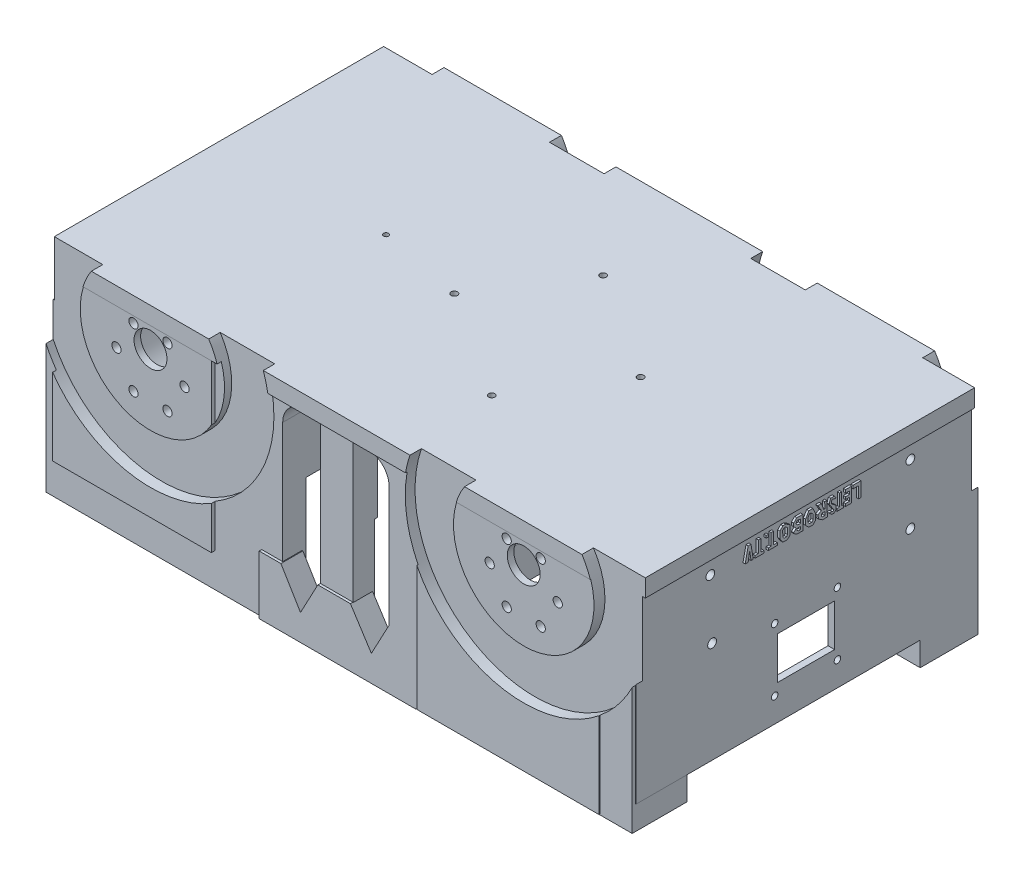
from build123d import *

# Parameters (mm, degrees)
MOTORHOLDERS_DEPTH             = 80
MOTORHOLDERS_DEPTH_BACK        = 80
MOTORHOLDERSSKETCH_R           = 23.41
MOTORHOLDERS_2_DEPTH           = 80
MOTORHOLDERS_2_DEPTH_BACK      = 80
SKETCH4_W                      = 262.774983374
SKETCH4_H                      = 153.112553215
CUT_EXTRUDE1_DEPTH             = 26
POWERBANKHOLDERS_DEPTH         = 40
POWERBANKHOLDERS_DEPTH_BACK    = 59
SKETCH6_W                      = 107.485666349
SKETCH6_H                      = 13.420779118
SKETCH6_W_2                    = 20.810206851
SKETCH6_H_2                    = 2.021058642
POWERBANKHOLDERS_2_DEPTH       = 40
POWERBANKHOLDERS_2_DEPTH_BACK  = 59
SKETCH6_W_3                    = 107.81575089
SKETCH6_H_3                    = 38.261259506
SKETCH6_W_4                    = 10.842850571
SKETCH6_H_4                    = 10.347679347
POWERBANKHOLDERS_3_DEPTH       = 40
POWERBANKHOLDERS_3_DEPTH_BACK  = 59
SKETCH6_W_5                    = 41.498763714
SKETCH6_H_5                    = 37.111507406
SKETCH6_W_6                    = 12.844328805
SKETCH6_H_6                    = 18.336479725
SKETCH6_W_7                    = 4.801433035
SKETCH6_H_7                    = 16.443461188
POWERBANKHOLDERS_4_DEPTH       = 40
POWERBANKHOLDERS_4_DEPTH_BACK  = 59
SKETCH6_W_8                    = 41.763104176
SKETCH6_H_8                    = 35.272094794
SKETCH6_W_9                    = 11.134493861
SKETCH6_H_9                    = 18.035399163
SKETCH6_W_10                   = 4.654088682
SKETCH6_H_10                   = 14.436538778
POWERBANKHOLDERS_5_DEPTH       = 40
POWERBANKHOLDERS_5_DEPTH_BACK  = 59
SKETCH6_W_11                   = 17.763333386
SKETCH6_H_11                   = 11.185766025
POWERBANKHOLDERS_6_DEPTH       = 40
POWERBANKHOLDERS_6_DEPTH_BACK  = 59
SKETCH6_W_12                   = 14.811929009
SKETCH6_H_12                   = 11.030658464
POWERBANKHOLDERS_7_DEPTH       = 40
POWERBANKHOLDERS_7_DEPTH_BACK  = 59
SKETCH6_W_13                   = 28.150495439
SKETCH6_H_13                   = 24.933985152
SKETCH6_W_14                   = 10.177859407
SKETCH6_H_14                   = 9.83070569
POWERBANKHOLDERS_8_DEPTH       = 40
POWERBANKHOLDERS_8_DEPTH_BACK  = 59
SKETCH6_W_15                   = 30.670744753
SKETCH6_H_15                   = 26.330219561
SKETCH6_W_16                   = 9.898416255
SKETCH6_H_16                   = 10.635603546
BOTTOMPLATE_DEPTH              = 5
BOTTOMPLATE_DEPTH_BACK         = 3
SKETCH21_R                     = 156.395305675
SKETCH23_W                     = 72.331231332
SKETCH23_H                     = 81.163054316
SKETCH23_W_2                   = 82.936115801
SKETCH23_H_2                   = 96.211163908
MOTORMOUNTINGSUPPORT1_DEPTH    = 6
SKETCH24_W                     = 78.341994801
SKETCH24_H                     = 94.439711356
SKETCH24_W_2                   = 53.914675369
SKETCH24_H_2                   = 86.674739968
MOTORMOUNTINGSUPPOR2_DEPTH     = 6
SKETCH17_R                     = 2.1
SKETCH17_R_2                   = 7.5
MOTORHOLES1_DEPTH              = 31.5
SKETCH19_R                     = 2.1
SKETCH19_R_2                   = 7.5
CUT_EXTRUDE4_DEPTH             = 30
BOLTHOLESSKETCH3_R             = 2.1
BOLTHOLESSKETCH3_R_2           = 7.5
MOTORHOLES3_DEPTH              = 31.5
BOLTHOLESSKETCH4_R             = 2.1
BOLTHOLESSKETCH4_R_2           = 7.5
MOTORHOLES4_DEPTH              = 15
SKETCH29_W                     = 154.635205036
SKETCH29_H                     = 84.131588093
SKETCH29_W_2                   = 26
SKETCH29_H_2                   = 19.212652328
BOSS_EXTRUDE8_DEPTH            = 3
SKETCH27_W                     = 226.46009322
SKETCH27_H                     = 129.985211715
BOSS_EXTRUDE6_DEPTH            = 3
SKETCH40_W                     = 33.841577611
SKETCH40_H                     = 31.531825246
BOSS_EXTRUDE11_DEPTH           = 40
FILLET2_R                      = 15
FILLET3_R                      = 15
POWERBANKCUT_START             = -54.404272
POWERBANKCUT_DEPTH             = 54.404272
MOTORHOLDERCUT_DEPTH           = 77
MOTORHOLDERCUT_DEPTH_BACK      = 77
MOTORHOLDEREXTRUDESKETCH_R     = 20.415
SKETCH31_W                     = 0.974071503
SKETCH31_H                     = 1.098893481
LABEL_DEPTH                    = 1
BASEDEFININGCUT_DEPTH          = 20
BASEDEFININGCUT_DEPTH_BACK     = 20
SKETCH32_W                     = 420.045569038
SKETCH32_H                     = 425.046527557
SKETCH32_W_2                   = 269.205670794
SKETCH32_H_2                   = 160.645125556
SKETCH36_R                     = 14
HOLEFORPOWERCONNECTOR_DEPTH    = 17
SKETCH37_W                     = 55.340133611
SKETCH37_H                     = 29.7708905
CUT_EXTRUDE7_DEPTH             = 36
SKETCH38_R                     = 1.145182774
CUT_EXTRUDE8_DEPTH             = 10
SPACEFORWHEEL1_DEPTH           = 10
SPACEFORWHEEL1_DEPTH_BACK      = 5
SKETCH41_R                     = 54.5
SKETCH41_R_2                   = 32
CUT_EXTRUDE10_DEPTH            = 10
CUT_EXTRUDE10_DEPTH_BACK       = 5
SKETCH42_R                     = 54.5
SKETCH42_R_2                   = 32
CUT_EXTRUDE11_DEPTH            = 10
CUT_EXTRUDE11_DEPTH_BACK       = 5
SKETCH43_R                     = 54.5
SKETCH43_R_2                   = 32
CUT_EXTRUDE12_DEPTH            = 10
CUT_EXTRUDE12_DEPTH_BACK       = 5
SKETCH44_R                     = 54.5
SKETCH44_R_2                   = 32
SKETCH45_W                     = 114.137539603
SKETCH45_H                     = 98.697181704
BACKPLATE_DEPTH                = 2
FILLET8_R                      = 10
FILLET9_R                      = 10
FILLET10_R                     = 10
FILLET11_R                     = 10
BOSS_EXTRUDE12_DEPTH           = 10
BOSS_EXTRUDE13_DEPTH           = 9
HOLESFORRASPIMOUNTING_R        = 1.414568566
HOLESFORRASPIMOUNTING_R_2      = 1.453568018
HOLESFORRASPIMOUNTING_R_3      = 1.430265165
HOLESFORRASPIMOUNTING_R_4      = 1.406429506
CUT_EXTRUDE13_DEPTH            = 252.922030729
HOLESFORCHARGINGPLATESSKETCH_R = 2
HOLESFORCHARGINGPLATES_DEPTH   = 3
SKETCH56_R                     = 1.5
CAMERASCREWHOLES_DEPTH         = 3


with BuildPart() as part:
    # MotorHoldersSketch → MotorHolders (new, two sides: drawn at the far end of the back side and taken through both)
    with BuildSketch(Plane.XY.offset(-MOTORHOLDERS_DEPTH_BACK)):
        Circle(MOTORHOLDERSSKETCH_R)
    extrude(amount=MOTORHOLDERS_DEPTH + MOTORHOLDERS_DEPTH_BACK)


with BuildPart() as body_2:
    # MotorHoldersSketch → MotorHolders 2 (new, two sides: drawn at the far end of the back side and taken through both)
    with BuildSketch(Plane.XY.offset(-MOTORHOLDERS_2_DEPTH_BACK)):
        with Locations((170, 0)):
            Circle(MOTORHOLDERSSKETCH_R)
    extrude(amount=MOTORHOLDERS_2_DEPTH + MOTORHOLDERS_2_DEPTH_BACK)


with BuildPart() as cut_extrude1_tool:
    # Sketch4 → Cut-Extrude1 (new body)
    with BuildSketch(Plane(origin=(0, 0, 0), x_dir=(1, 0, 0), z_dir=(0, 1, 0))):
        with Locations((89.893628689, 0.176832173)):
            Rectangle(SKETCH4_W, SKETCH4_H)
    extrude(amount=-CUT_EXTRUDE1_DEPTH)


with BuildPart() as part_1:
    add(part.part)

    # Cut-Extrude1: cut by cut_extrude1_tool
    add(cut_extrude1_tool.part, mode=Mode.SUBTRACT)


with BuildPart() as body_2_1:
    add(body_2.part)

    # Cut-Extrude1: cut by cut_extrude1_tool
    add(cut_extrude1_tool.part, mode=Mode.SUBTRACT)


with BuildPart() as body_3:
    # Sketch6 → PowerBankHolders (new, two sides: drawn at the far end of the back side and taken through both)
    with BuildSketch(Plane(origin=(170, -34.829272125, 0), x_dir=(-1, 0, 0), z_dir=(0, -1, 0)).offset(-POWERBANKHOLDERS_DEPTH_BACK)):
        with Locations((165.843013364, 72.238602394)):
            Rectangle(SKETCH6_W, SKETCH6_H)
        with Locations((203.359863582, 72.025840015)):
            Rectangle(SKETCH6_W_2, SKETCH6_H_2, mode=Mode.SUBTRACT)
    extrude(amount=POWERBANKHOLDERS_DEPTH + POWERBANKHOLDERS_DEPTH_BACK)



with BuildPart() as body_4:
    # Sketch6 → PowerBankHolders 2 (new, two sides: drawn at the far end of the back side and taken through both)
    with BuildSketch(Plane(origin=(170, -34.829272125, 0), x_dir=(-1, 0, 0), z_dir=(0, -1, 0)).offset(-POWERBANKHOLDERS_2_DEPTH_BACK)):
        with Locations((165.406852056, -59.151522269)):
            Rectangle(SKETCH6_W_3, SKETCH6_H_3)
        with Locations((206.519672379, -65.314281269)):
            Rectangle(SKETCH6_W_4, SKETCH6_H_4, mode=Mode.SUBTRACT)
    extrude(amount=POWERBANKHOLDERS_2_DEPTH + POWERBANKHOLDERS_2_DEPTH_BACK)


with BuildPart() as body_5:
    # Sketch6 → PowerBankHolders 3 (new, two sides: drawn at the far end of the back side and taken through both)
    with BuildSketch(Plane(origin=(170, -34.829272125, 0), x_dir=(-1, 0, 0), z_dir=(0, -1, 0)).offset(-POWERBANKHOLDERS_3_DEPTH_BACK)):
        with Locations((40.739743063, 59.306920349)):
            Rectangle(SKETCH6_W_5, SKETCH6_H_5)
        with Locations((34.93306737, 60.00949088)):
            Rectangle(SKETCH6_W_6, SKETCH6_H_6, mode=Mode.SUBTRACT)
        with Locations((56.270377412, 59.541495334)):
            Rectangle(SKETCH6_W_7, SKETCH6_H_7, mode=Mode.SUBTRACT)
    extrude(amount=POWERBANKHOLDERS_3_DEPTH + POWERBANKHOLDERS_3_DEPTH_BACK)


with BuildPart() as body_6:
    # Sketch6 → PowerBankHolders 4 (new, two sides: drawn at the far end of the back side and taken through both)
    with BuildSketch(Plane(origin=(170, -34.829272125, 0), x_dir=(-1, 0, 0), z_dir=(0, -1, 0)).offset(-POWERBANKHOLDERS_4_DEPTH_BACK)):
        with Locations((40.966801585, -61.807610384)):
            Rectangle(SKETCH6_W_8, SKETCH6_H_8)
        with Locations((37.73953158, -63.792391966)):
            Rectangle(SKETCH6_W_9, SKETCH6_H_9, mode=Mode.SUBTRACT)
        with Locations((54.037759341, -62.645522509)):
            Rectangle(SKETCH6_W_10, SKETCH6_H_10, mode=Mode.SUBTRACT)
    extrude(amount=POWERBANKHOLDERS_4_DEPTH + POWERBANKHOLDERS_4_DEPTH_BACK)


with BuildPart() as body_7:
    # Sketch6 → PowerBankHolders 5 (new, two sides: drawn at the far end of the back side and taken through both)
    with BuildSketch(Plane(origin=(170, -34.829272125, 0), x_dir=(-1, 0, 0), z_dir=(0, -1, 0)).offset(-POWERBANKHOLDERS_5_DEPTH_BACK)):
        with Locations((88.297855443, 73.356108941)):
            Rectangle(SKETCH6_W_11, SKETCH6_H_11)
    extrude(amount=POWERBANKHOLDERS_5_DEPTH + POWERBANKHOLDERS_5_DEPTH_BACK)


with BuildPart() as body_8:
    # Sketch6 → PowerBankHolders 6 (new, two sides: drawn at the far end of the back side and taken through both)
    with BuildSketch(Plane(origin=(170, -34.829272125, 0), x_dir=(-1, 0, 0), z_dir=(0, -1, 0)).offset(-POWERBANKHOLDERS_6_DEPTH_BACK)):
        with Locations((86.822153254, -72.76682279)):
            Rectangle(SKETCH6_W_12, SKETCH6_H_12)
    extrude(amount=POWERBANKHOLDERS_6_DEPTH + POWERBANKHOLDERS_6_DEPTH_BACK)


with BuildPart() as body_9:
    # Sketch6 → PowerBankHolders 7 (new, two sides: drawn at the far end of the back side and taken through both)
    with BuildSketch(Plane(origin=(170, -34.829272125, 0), x_dir=(-1, 0, 0), z_dir=(0, -1, 0)).offset(-POWERBANKHOLDERS_7_DEPTH_BACK)):
        with Locations((-34.775388772, -66.976665205)):
            Rectangle(SKETCH6_W_13, SKETCH6_H_13)
        with Locations((-36.725173705, -67.894738702)):
            Rectangle(SKETCH6_W_14, SKETCH6_H_14, mode=Mode.SUBTRACT)
    extrude(amount=POWERBANKHOLDERS_7_DEPTH + POWERBANKHOLDERS_7_DEPTH_BACK)


with BuildPart() as body_10:
    # Sketch6 → PowerBankHolders 8 (new, two sides: drawn at the far end of the back side and taken through both)
    with BuildSketch(Plane(origin=(170, -34.829272125, 0), x_dir=(-1, 0, 0), z_dir=(0, -1, 0)).offset(-POWERBANKHOLDERS_8_DEPTH_BACK)):
        with Locations((-33.722690809, 64.697564271)):
            Rectangle(SKETCH6_W_15, SKETCH6_H_15)
        with Locations((-36.585452129, 63.859928969)):
            Rectangle(SKETCH6_W_16, SKETCH6_H_16, mode=Mode.SUBTRACT)
    extrude(amount=POWERBANKHOLDERS_8_DEPTH + POWERBANKHOLDERS_8_DEPTH_BACK)


with BuildPart() as body_3_1:
    add(body_3.part)

    add(body_4.part)  # BottomPlate merges body 4

    add(body_2_1.part)  # BottomPlate merges body 2

    add(part_1.part)  # BottomPlate merges part

    add(body_5.part)  # BottomPlate merges body 5

    add(body_6.part)  # BottomPlate merges body 6
    # Sketch21 → BottomPlate (add, two sides: drawn at the far end of the back side and taken through both)
    with BuildSketch(Plane(origin=(0, 19.575, 0), x_dir=(1, 0, 0), z_dir=(0, 1, 0)).offset(-BOTTOMPLATE_DEPTH_BACK)):
        with Locations(Location((85, 0, 0), (0, 0, 270))):
            Circle(SKETCH21_R)
    extrude(amount=BOTTOMPLATE_DEPTH + BOTTOMPLATE_DEPTH_BACK)


    add(body_9.part)  # MotorMountingSupport1 merges body 9
    # Sketch23 → MotorMountingSupport1 (add)
    with BuildSketch(Plane.XY.offset(80)):
        with Locations((-8.424510745, -18.741332274)):
            Rectangle(SKETCH23_W, SKETCH23_H)
        with Locations((162.789906406, -26.26538707)):
            Rectangle(SKETCH23_W_2, SKETCH23_H_2)
    extrude(amount=-MOTORMOUNTINGSUPPORT1_DEPTH)


    add(body_10.part)  # MotorMountingSuppor2 merges body 10
    # Sketch24 → MotorMountingSuppor2 (add)
    with BuildSketch(Plane(origin=(0, 0, -80), x_dir=(-1, 0, 0), z_dir=(0, 0, -1))):
        with Locations((-163.019522912, -27.982448794)):
            Rectangle(SKETCH24_W, SKETCH24_H)
        with Locations((2.593149567, -20.814772641)):
            Rectangle(SKETCH24_W_2, SKETCH24_H_2)
    extrude(amount=-MOTORMOUNTINGSUPPOR2_DEPTH)

    # Sketch17 → MotorHoles1 (cut)
    with BuildSketch(Plane.XY.offset(80)):
        with Locations((185.5, 0)):
            Circle(SKETCH17_R)
        with Locations((177.75, -13.42)):
            Circle(SKETCH17_R)
        with Locations((162.25, -13.42)):
            Circle(SKETCH17_R)
        with Locations((154.5, 0)):
            Circle(SKETCH17_R)
        with Locations((162.25, 13.42)):
            Circle(SKETCH17_R)
        with Locations((177.75, 13.42)):
            Circle(SKETCH17_R)
        with Locations((170, 7)):
            Circle(SKETCH17_R_2)
    extrude(amount=-MOTORHOLES1_DEPTH, mode=Mode.SUBTRACT)

    # Sketch19 → Cut-Extrude4 (cut)
    with BuildSketch(Plane(origin=(0, 0, -80), x_dir=(-1, 0, 0), z_dir=(0, 0, -1))):
        with Locations(Location((-185.5, 0, 0), (0, 0, 180))):
            Circle(SKETCH19_R)
        with Locations(Location((-177.75, -13.42, 0), (0, 0, 180))):
            Circle(SKETCH19_R)
        with Locations(Location((-162.25, -13.42, 0), (0, 0, 180))):
            Circle(SKETCH19_R)
        with Locations(Location((-154.5, 0, 0), (0, 0, 180))):
            Circle(SKETCH19_R)
        with Locations(Location((-162.25, 13.42, 0), (0, 0, 180))):
            Circle(SKETCH19_R)
        with Locations(Location((-177.75, 13.42, 0), (0, 0, 180))):
            Circle(SKETCH19_R)
        with Locations(Location((-170, 7, 0), (0, 0, 180))):
            Circle(SKETCH19_R_2)
    extrude(amount=-CUT_EXTRUDE4_DEPTH, mode=Mode.SUBTRACT)

    # BoltHolesSketch3 → MotorHoles3 (cut)
    with BuildSketch(Plane.XY.offset(80)):
        with Locations((7.75, -13.42)):
            Circle(BOLTHOLESSKETCH3_R)
        with Locations((15.5, 0)):
            Circle(BOLTHOLESSKETCH3_R)
        with Locations((7.75, 13.42)):
            Circle(BOLTHOLESSKETCH3_R)
        with Locations((-7.75, 13.42)):
            Circle(BOLTHOLESSKETCH3_R)
        with Locations((-15.5, 0)):
            Circle(BOLTHOLESSKETCH3_R)
        with Locations((-7.75, -13.42)):
            Circle(BOLTHOLESSKETCH3_R)
        with Locations((0, 7)):
            Circle(BOLTHOLESSKETCH3_R_2)
    extrude(amount=-MOTORHOLES3_DEPTH, mode=Mode.SUBTRACT)

    # BoltHolesSketch4 → MotorHoles4 (cut)
    with BuildSketch(Plane(origin=(0, 0, -80), x_dir=(-1, 0, 0), z_dir=(0, 0, -1))):
        with Locations(Location((-15.5, 0, 0), (0, 0, 180))):
            Circle(BOLTHOLESSKETCH4_R)
        with Locations(Location((-7.75, 13.42, 0), (0, 0, 180))):
            Circle(BOLTHOLESSKETCH4_R)
        with Locations(Location((7.75, 13.42, 0), (0, 0, 180))):
            Circle(BOLTHOLESSKETCH4_R)
        with Locations(Location((15.5, 0, 0), (0, 0, 180))):
            Circle(BOLTHOLESSKETCH4_R)
        with Locations(Location((7.75, -13.42, 0), (0, 0, 180))):
            Circle(BOLTHOLESSKETCH4_R)
        with Locations(Location((-7.75, -13.42, 0), (0, 0, 180))):
            Circle(BOLTHOLESSKETCH4_R)
        with Locations(Location((0, 7, 0), (0, 0, 180))):
            Circle(BOLTHOLESSKETCH4_R_2)
    extrude(amount=-MOTORHOLES4_DEPTH, mode=Mode.SUBTRACT)

    # Sketch29 → Boss-Extrude8 (add)
    with BuildSketch(Plane(origin=(219.058063185, 0, 0), x_dir=(0, 0, -1), z_dir=(1, 0, 0))):
        with Locations((-0.622085312, -21.859578752)):
            Rectangle(SKETCH29_W, SKETCH29_H)
        with Locations((-0.45071267, -38.546737855)):
            Rectangle(SKETCH29_W_2, SKETCH29_H_2, mode=Mode.SUBTRACT)
    extrude(amount=-BOSS_EXTRUDE8_DEPTH)

    # Sketch27 → Boss-Extrude6 (add)
    with BuildSketch(Plane(origin=(0, 16.575, 0), x_dir=(-1, 0, 0), z_dir=(0, -1, 0))):
        with Locations((-81.596376522, -0.440920076)):
            Rectangle(SKETCH27_W, SKETCH27_H)
    extrude(amount=-BOSS_EXTRUDE6_DEPTH)

    # Sketch40 → Boss-Extrude11 (add)
    with BuildSketch(Plane.XZ.offset(-16.575)):
        with Locations((-32.665057733, -49.762300212)):
            Rectangle(SKETCH40_W, SKETCH40_H)
    extrude(amount=BOSS_EXTRUDE11_DEPTH)

    # Fillet2
    fillet2_edges = [body_3_1.edges().sort_by_distance(p)[0] for p in [
        (-33.058778866, 16.575, -33.996387589),
    ]]
    fillet(fillet2_edges, radius=FILLET2_R)

    # Fillet3
    fillet3_edges = [body_3_1.edges().sort_by_distance(p)[0] for p in [
        (-32.665057733, -23.425, -65.528212835),
    ]]
    fillet(fillet3_edges, radius=FILLET3_R)


with BuildPart() as powerbankcut_tool:
    # Sketch11 → PowerBankCut (new body)
    with BuildSketch(Plane(origin=(0, -20.425, 0), x_dir=(1, 0, 0), z_dir=(0, 1, 0)).offset(POWERBANKCUT_START)):
        Polygon((-34.216190018, -64.758061011), (-34.216190018, 73.342459946), (204.216190018, 63.61100878), (204.216190018, -72.195407715), align=None)
    extrude(amount=POWERBANKCUT_DEPTH)


with BuildPart() as body_3_2:
    add(body_3_1.part)

    # PowerBankCut: cut by powerbankcut_tool
    add(powerbankcut_tool.part, mode=Mode.SUBTRACT)

    # MotorHolderExtrudeSketch → MotorHolderCut (cut, two sides: drawn at the far end of the back side and taken through both)
    with BuildSketch(Plane.XY.offset(-MOTORHOLDERCUT_DEPTH_BACK)):
        with Locations((170, 0)):
            Circle(MOTORHOLDEREXTRUDESKETCH_R)
        Circle(MOTORHOLDEREXTRUDESKETCH_R)
    extrude(amount=MOTORHOLDERCUT_DEPTH + MOTORHOLDERCUT_DEPTH_BACK, mode=Mode.SUBTRACT)

    # Sketch31 → Label (add)
    # profile 1 of 12: a face of its own
    with BuildSketch(Plane(origin=(219.058063185, 0, 0), x_dir=(0, 0, -1), z_dir=(1, 0, 0))):
        Polygon((-11.98526985, 13.439841291), (-13.362429362, 12.062681779), (-13.362429362, 8.945190615), (-11.98526985, 6.974827343), (-9.953373529, 6.95345362), (-8.833106325, 8.073720824), (-8.833106325, 12.34094781), (-10.701068375, 13.439841291), align=None)
        Polygon((-10.345814415, 8.2738545), (-9.953373529, 8.945190615), (-9.953373529, 11.821646598), (-10.901774719, 12.34094781), (-11.49193497, 12.34094781), (-12.148090666, 11.684792113), (-11.98526985, 8.945190615), (-11.49193497, 8.2738545), align=None, mode=Mode.SUBTRACT)
    # profile 2 of 12: a face of its own
    with BuildSketch(Plane(origin=(219.058063185, 0, 0), x_dir=(0, 0, -1), z_dir=(1, 0, 0))):
        Polygon((23.558293829, 6.787698441), (23.558293829, 13.439841291), (19.973591213, 13.439841291), (19.973591213, 12.023569573), (22.495339762, 12.023569573), (22.495339762, 6.787698441), align=None)
    # profile 3 of 12: a face of its own
    with BuildSketch(Plane(origin=(219.058063185, 0, 0), x_dir=(0, 0, -1), z_dir=(1, 0, 0))):
        Polygon((19.346446684, 13.439841291), (19.346446684, 6.787698441), (16.517360922, 6.787698441), (16.517360922, 7.948175313), (18.37406964, 7.948175313), (18.37406964, 9.531498705), (16.517360922, 9.531498705), (16.517360922, 10.627422136), (18.37406964, 10.627422136), (18.37406964, 12.023569573), (16.517360922, 12.023569573), (16.517360922, 13.439841291), align=None)
    # profile 4 of 12: a face of its own
    with BuildSketch(Plane(origin=(219.058063185, 0, 0), x_dir=(0, 0, -1), z_dir=(1, 0, 0))):
        Polygon((15.6230908, 6.787698441), (15.6230908, 7.948175313), (14.771034344, 7.948175313), (14.771034344, 13.439841291), (13.818992027, 13.439841291), (13.818992027, 7.948175313), (12.716212392, 7.948175313), (12.716212392, 6.787698441), align=None)
    # profile 5 of 12: a face of its own
    with BuildSketch(Plane(origin=(219.058063185, 0, 0), x_dir=(0, 0, -1), z_dir=(1, 0, 0))):
        Polygon((9.073737582, 7.948175313), (10.234214453, 6.787698441), (11.244633534, 6.787698441), (12.155982843, 7.69904775), (12.155982843, 9.531498705), (10.234214453, 10.87364909), (10.108627026, 12.023569573), (10.670416344, 12.771980083), (11.244633534, 12.34094781), (12.155982843, 12.34094781), (11.481366322, 13.439841291), (9.687471608, 13.439841291), (9.073737582, 11.400796773), (11.244633534, 8.073720824), (10.670416344, 7.69904775), (10.234214453, 7.948175313), align=None)
    # profile 6 of 12: a face of its own
    with BuildSketch(Plane(origin=(219.058063185, 0, 0), x_dir=(0, 0, -1), z_dir=(1, 0, 0))):
        Polygon((-20.664013689, 6.974827343), (-20.664013689, 8.073720824), (-22.08006238, 8.073720824), (-22.08006238, 13.439841291), (-23.226194473, 13.439841291), (-23.226194473, 8.073720824), (-24.618837263, 8.073720824), (-24.618837263, 6.974827343), align=None)
    # profile 7 of 12: a face of its own
    with BuildSketch(Plane(origin=(219.058063185, 0, 0), x_dir=(0, 0, -1), z_dir=(1, 0, 0))):
        with Locations((-19.147573552, 12.890394551)):
            Rectangle(SKETCH31_W, SKETCH31_H)
    # profile 8 of 12: a face of its own
    with BuildSketch(Plane(origin=(219.058063185, 0, 0), x_dir=(0, 0, -1), z_dir=(1, 0, 0))):
        Polygon((8.012217861, 13.439841291), (8.252984515, 6.787698441), (6.012763426, 6.787698441), (4.268498284, 7.948175313), (3.899074993, 9.786306376), (5.542554696, 10.627422136), (3.899074993, 13.439841291), (5.542554696, 13.439841291), (6.570085761, 10.627422136), (7.132873971, 10.627422136), (7.031081696, 13.439841291), align=None)
        Polygon((7.132873971, 7.948175313), (7.132873971, 9.531498705), (6.012763426, 9.531498705), (5.542554696, 9.061289975), (5.542554696, 8.424607496), (6.093168856, 7.873993337), align=None, mode=Mode.SUBTRACT)
    # profile 9 of 12: a face of its own
    with BuildSketch(Plane(origin=(219.058063185, 0, 0), x_dir=(0, 0, -1), z_dir=(1, 0, 0))):
        Polygon((1.668377669, 13.439841291), (-0.18268922, 13.439841291), (-1.653843096, 10.87364909), (-1.653843096, 8.424607496), (-0.18268922, 6.95345362), (1.668377669, 6.95345362), (2.949535386, 8.234611337), (2.949535386, 10.627422136), align=None)
        Polygon((1.106611738, 8.234611337), (1.817191017, 8.945190615), (1.817191017, 11.1370693), (0.82545405, 12.128806267), (0.211816494, 12.128806267), (-0.525032893, 11.1370693), (-0.629448455, 9.225348019), (0.015929602, 8.2738545), align=None, mode=Mode.SUBTRACT)
    # profile 10 of 12: a face of its own
    with BuildSketch(Plane(origin=(219.058063185, 0, 0), x_dir=(0, 0, -1), z_dir=(1, 0, 0))):
        Polygon((-2.9468055, 6.95345362), (-2.9468055, 13.439841291), (-5.696037883, 13.439841291), (-7.112309601, 12.023569573), (-7.112309601, 10.627422136), (-5.934130831, 9.449243366), (-7.112309601, 8.271064596), (-7.112309601, 7.948175313), (-5.696037883, 6.95345362), align=None)
        Polygon((-4.060808068, 9.225348019), (-5.41718129, 9.225348019), (-5.696037883, 8.424607496), (-4.99918603, 7.948175313), (-4.060808068, 7.948175313), align=None, mode=Mode.SUBTRACT)
        Polygon((-3.896074702, 10.379415269), (-3.896074702, 12.128806267), (-5.57390472, 12.34094781), (-6.066131269, 11.254110768), (-5.25703013, 10.379415269), align=None, mode=Mode.SUBTRACT)
    # profile 11 of 12: a face of its own
    with BuildSketch(Plane(origin=(219.058063185, 0, 0), x_dir=(0, 0, -1), z_dir=(1, 0, 0))):
        Polygon((-25.51871314, 6.974827343), (-26.536636447, 13.439841291), (-27.812598845, 13.439841291), (-29.185493107, 6.974827343), (-27.812598845, 6.974827343), (-27.174617646, 11.254110768), (-26.500839929, 6.974827343), align=None)
    # profile 12 of 12: a face of its own
    with BuildSketch(Plane(origin=(219.058063185, 0, 0), x_dir=(0, 0, -1), z_dir=(1, 0, 0))):
        Polygon((-14.54036824, 6.974827343), (-18.6605378, 6.974827343), (-18.6605378, 8.073720824), (-17.332470001, 8.073720824), (-17.332470001, 13.439841291), (-16.175385543, 13.439841291), (-16.175385543, 8.073720824), (-14.54036824, 8.073720824), align=None)
    extrude(amount=LABEL_DEPTH)

    # Sketch32 → BaseDefiningCut (cut, two sides: drawn at the far end of the back side and taken through both)
    with BuildSketch(Plane(origin=(0, 19.575, 0), x_dir=(1, 0, 0), z_dir=(0, 1, 0)).offset(-BASEDEFININGCUT_DEPTH_BACK)):
        with Locations((73.53385004, -6.203492346)):
            Rectangle(SKETCH32_W, SKETCH32_H)
        with Locations((85.789158114, 0.107563087)):
            Rectangle(SKETCH32_W_2, SKETCH32_H_2, mode=Mode.SUBTRACT)
    extrude(amount=BASEDEFININGCUT_DEPTH + BASEDEFININGCUT_DEPTH_BACK, mode=Mode.SUBTRACT)

    # Sketch36 → HoleForPowerConnector (cut)
    with BuildSketch(Plane.ZY.offset(49.314727501)):
        with Locations((55.06657986, -55.074157533)):
            Circle(SKETCH36_R)
    extrude(amount=-HOLEFORPOWERCONNECTOR_DEPTH, mode=Mode.SUBTRACT)

    # Sketch37 → Cut-Extrude7 (cut)
    with BuildSketch(Plane.XZ.offset(20.425)):
        with Locations((116.745978541, -50.558354808)):
            Rectangle(SKETCH37_W, SKETCH37_H)
    extrude(amount=-CUT_EXTRUDE7_DEPTH, mode=Mode.SUBTRACT)

    # Sketch38 → Cut-Extrude8 (cut)
    with BuildSketch(Plane.XZ.offset(-16.575)):
        with Locations(Location((25.99644574, -1.316498015, 0), (0, 0, 270))):
            Circle(SKETCH38_R)
    extrude(amount=-CUT_EXTRUDE8_DEPTH, mode=Mode.SUBTRACT)

    # Sketch41 → SpaceForWheel1 (cut, two sides: drawn at the far end of the back side and taken through both)
    with BuildSketch(Plane.XY.offset(80).offset(-SPACEFORWHEEL1_DEPTH_BACK)):
        with Locations((0, 7)):
            Circle(SKETCH41_R)
        with Locations((0, 7)):
            Circle(SKETCH41_R_2, mode=Mode.SUBTRACT)
    extrude(amount=SPACEFORWHEEL1_DEPTH + SPACEFORWHEEL1_DEPTH_BACK, mode=Mode.SUBTRACT)

    # Sketch42 → Cut-Extrude10 (cut, two sides: drawn at the far end of the back side and taken through both)
    with BuildSketch(Plane.XY.offset(80).offset(-CUT_EXTRUDE10_DEPTH_BACK)):
        with Locations((170, 7)):
            Circle(SKETCH42_R)
        with Locations((170, 7)):
            Circle(SKETCH42_R_2, mode=Mode.SUBTRACT)
    extrude(amount=CUT_EXTRUDE10_DEPTH + CUT_EXTRUDE10_DEPTH_BACK, mode=Mode.SUBTRACT)

    # Sketch43 → Cut-Extrude11 (cut, two sides: drawn at the far end of the back side and taken through both)
    with BuildSketch(Plane(origin=(0, 0, -80), x_dir=(-1, 0, 0), z_dir=(0, 0, -1)).offset(-CUT_EXTRUDE11_DEPTH_BACK)):
        with Locations((-170, 7)):
            Circle(SKETCH43_R)
        with Locations((-170, 7)):
            Circle(SKETCH43_R_2, mode=Mode.SUBTRACT)
    extrude(amount=CUT_EXTRUDE11_DEPTH + CUT_EXTRUDE11_DEPTH_BACK, mode=Mode.SUBTRACT)

    # Sketch44 → Cut-Extrude12 (cut, two sides: drawn at the far end of the back side and taken through both)
    with BuildSketch(Plane(origin=(0, 0, -80), x_dir=(-1, 0, 0), z_dir=(0, 0, -1)).offset(-CUT_EXTRUDE12_DEPTH_BACK)):
        with Locations((0, 7)):
            Circle(SKETCH44_R)
        with Locations((0, 7)):
            Circle(SKETCH44_R_2, mode=Mode.SUBTRACT)
    extrude(amount=CUT_EXTRUDE12_DEPTH + CUT_EXTRUDE12_DEPTH_BACK, mode=Mode.SUBTRACT)

    # Sketch45 → BackPlate (add)
    with BuildSketch(Plane.ZY.offset(48.813677283)):
        with Locations((-15.037538426, -24.773590852)):
            Rectangle(SKETCH45_W, SKETCH45_H)
    extrude(amount=-BACKPLATE_DEPTH)

    # Fillet8
    fillet8_edges = [body_3_2.edges().sort_by_distance(p)[0] for p in [
        (57.89981981, 16.575, -72.238602394),
    ]]
    fillet(fillet8_edges, radius=FILLET8_R)

    # Fillet9
    # the kernel refuses this fillet: 10 mm, written as the material it adds along each edge
    with BuildSketch(Plane(origin=(108.51087508, 16.575, -77.862674052), x_dir=(0, -1, 0), z_dir=(0, 0, 1))) as fillet9_piece_1_section:
        with BuildLine():
            CenterArc((FILLET9_R, -FILLET9_R), FILLET9_R, 90, 90)
            Line((0, -FILLET9_R), (0, 0))
            Line((0, 0), (FILLET9_R, 0))
        make_face()
    fillet9_piece_1 = extrude(amount=37.111507406, mode=Mode.PRIVATE)
    fillet9_piece_1 = split(fillet9_piece_1, bisect_by=Plane(origin=(107.13497171, 15.575, -71.653237055), z_dir=(0, -1, 0)), keep=Keep.TOP, mode=Mode.PRIVATE)
    fillet9_piece_1 = split(fillet9_piece_1, bisect_by=Plane(origin=(107.13497171, 13.204405478, -65.443800058), z_dir=(0, 0, -1)), keep=Keep.TOP, mode=Mode.PRIVATE)
    add(fillet9_piece_1)
    with BuildSketch(Plane(origin=(108.51087508, 16.575, -77.862674052), x_dir=(0, -1, 0), z_dir=(0, 0, 1))) as fillet9_piece_2_section:
        with BuildLine():
            CenterArc((FILLET9_R, -FILLET9_R), FILLET9_R, 90, 90)
            Line((0, -FILLET9_R), (0, 0))
            Line((0, 0), (FILLET9_R, 0))
        make_face()
    fillet9_piece_2 = extrude(amount=37.111507406, mode=Mode.PRIVATE)
    fillet9_piece_2 = split(fillet9_piece_2, bisect_by=Plane(origin=(104.700954064, 15.575, -71.653237055), z_dir=(0, 1, 0)), keep=Keep.TOP, mode=Mode.PRIVATE)
    fillet9_piece_2 = split(fillet9_piece_2, bisect_by=Plane(origin=(104.700954064, 16.237563822, -65.443800058), z_dir=(0, 0, -1)), keep=Keep.TOP, mode=Mode.PRIVATE)
    add(fillet9_piece_2)
    with BuildSketch(Plane(origin=(108.51087508, 16.575, -77.862674052), x_dir=(0, -1, 0), z_dir=(0, 0, 1))) as fillet9_piece_3_section:
        with BuildLine():
            CenterArc((FILLET9_R, -FILLET9_R), FILLET9_R, 90, 90)
            Line((0, -FILLET9_R), (0, 0))
            Line((0, 0), (FILLET9_R, 0))
        make_face()
    fillet9_piece_3 = extrude(amount=37.111507406, mode=Mode.PRIVATE)
    fillet9_piece_3 = split(fillet9_piece_3, bisect_by=Plane(origin=(104.700954064, 15.575, -53.097483352), z_dir=(0, 1, 0)), keep=Keep.TOP, mode=Mode.PRIVATE)
    fillet9_piece_3 = split(fillet9_piece_3, bisect_by=Plane(origin=(104.700954064, 16.237563822, -65.443800058), z_dir=(0, 0, 1)), keep=Keep.TOP, mode=Mode.PRIVATE)
    add(fillet9_piece_3)

    # Fillet10
    fillet10_edges = [body_3_2.edges().sort_by_distance(p)[0] for p in [
        (108.151646327, 16.575, 61.807610384),
    ]]
    fillet(fillet10_edges, radius=FILLET10_R)

    # Fillet11
    fillet11_edges = [body_3_2.edges().sort_by_distance(p)[0] for p in [
        (58.501023389, 16.575, 59.151522269),
    ]]
    fillet(fillet11_edges, radius=FILLET11_R)



with BuildPart() as body_7_1:
    add(body_7.part)

    # PowerBankCut: cut by powerbankcut_tool
    add(powerbankcut_tool.part, mode=Mode.SUBTRACT)


with BuildPart() as body_8_1:
    add(body_8.part)

    # PowerBankCut: cut by powerbankcut_tool
    add(powerbankcut_tool.part, mode=Mode.SUBTRACT)


with BuildPart() as body_3_3:
    add(body_3_2.part)

    add(body_8_1.part)  # Boss-Extrude12 merges body 8
    # Sketch51 → Boss-Extrude12 (add)
    with BuildSketch(Plane.XY.offset(79.443657781)):
        Polygon((108.151646327, -47.98038528), (100.046955512, -63.179220835), (90.516348019, -48.336772286), (75.676177949, -48.336772286), (67.761528435, -63.179220835), (58.839832918, -48.336772286), (48.929052362, -48.336772286), (48.929052362, -75.040734929), (120.251371925, -75.040734929), (120.251371925, -47.98038528), align=None)
    extrude(amount=-BOSS_EXTRUDE12_DEPTH)


    add(body_7_1.part)  # Boss-Extrude13 merges body 7
    # Sketch53 → Boss-Extrude13 (add)
    with BuildSketch(Plane(origin=(0, 0, -77.862674052), x_dir=(-1, 0, 0), z_dir=(0, 0, -1))):
        Polygon((-57.799247354, -55.761623835), (-64.666800666, -65.107182533), (-72.754062458, -55.761623835), (-90.655375706, -55.761623835), (-98.668066194, -65.107182533), (-108.51087508, -55.761623835), (-123.848525511, -55.761623835), (-123.848525511, -74.829272125), (-52.438264255, -74.829272125), (-52.438264255, -55.761623835), align=None)
    extrude(amount=-BOSS_EXTRUDE13_DEPTH)

    # HolesForRasPiMounting → Cut-Extrude13 (cut, through all)
    with BuildSketch(Plane.XZ.offset(-16.575)):
        with Locations(Location((91.467826322, -34.695989326, 0), (0, 0, 270))):
            Circle(HOLESFORRASPIMOUNTING_R)
        with Locations(Location((64.780513606, 6.398868504, 0), (0, 0, 270))):
            Circle(HOLESFORRASPIMOUNTING_R_2)
        with Locations(Location((140.110719263, -3.106925295, 0), (0, 0, 270))):
            Circle(HOLESFORRASPIMOUNTING_R_3)
        with Locations(Location((113.423406547, 37.987932534, 0), (0, 0, 270))):
            Circle(HOLESFORRASPIMOUNTING_R_4)
    extrude(amount=-CUT_EXTRUDE13_DEPTH, mode=Mode.SUBTRACT)

    # HolesForChargingPlatesSketch → HolesForChargingPlates (cut)
    with BuildSketch(Plane(origin=(219.058063185, 0, 0), x_dir=(0, 0, -1), z_dir=(1, 0, 0))):
        with Locations((47.060045129, -17.739047969)):
            Circle(HOLESFORCHARGINGPLATESSKETCH_R)
        with Locations((-43.254232653, -17.739047969)):
            Circle(HOLESFORCHARGINGPLATESSKETCH_R)
        with Locations((-44.046532468, 9.537592727)):
            Circle(HOLESFORCHARGINGPLATESSKETCH_R)
        with Locations((47.060045129, 9.537592727)):
            Circle(HOLESFORCHARGINGPLATESSKETCH_R)
    extrude(amount=-HOLESFORCHARGINGPLATES_DEPTH, mode=Mode.SUBTRACT)

    # Sketch56 → CameraScrewHoles (cut)
    with BuildSketch(Plane(origin=(219.058063185, 0, 0), x_dir=(0, 0, -1), z_dir=(1, 0, 0))):
        with Locations((13.842180549, -52.839631074)):
            Circle(SKETCH56_R)
        with Locations((-14.743605889, -52.839631074)):
            Circle(SKETCH56_R)
        with Locations((-14.743605889, -24.253844636)):
            Circle(SKETCH56_R)
        with Locations((13.842180549, -24.253844636)):
            Circle(SKETCH56_R)
    extrude(amount=-CAMERASCREWHOLES_DEPTH, mode=Mode.SUBTRACT)


solid = body_3_3.part
